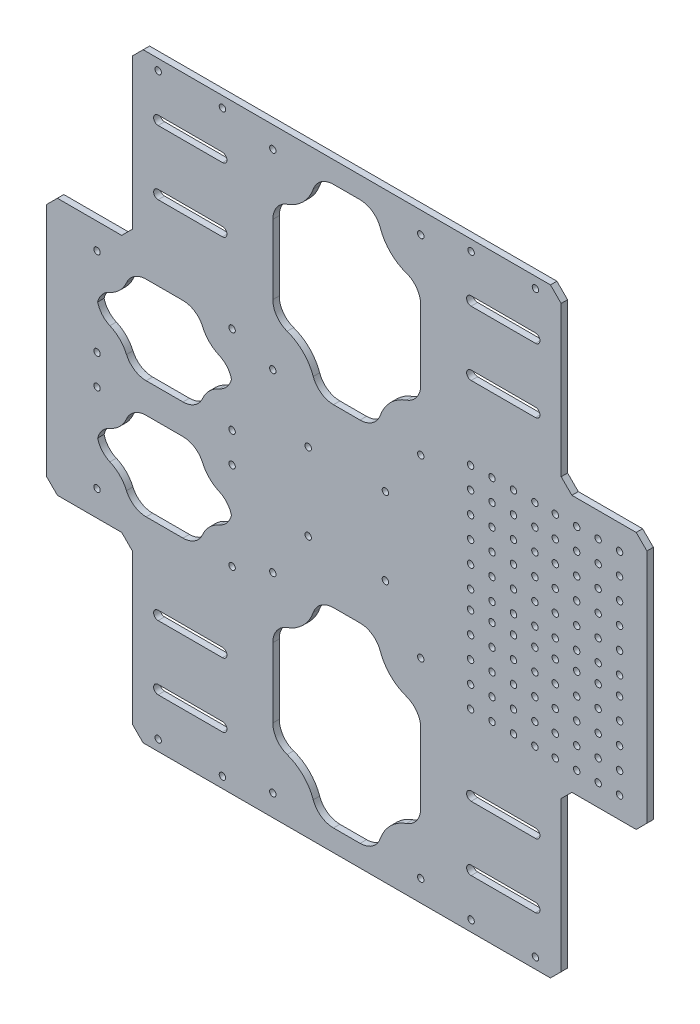
from build123d import *

# Parameters (mm, degrees)
SKETCH_1_R          = 1.5
EXTRUDE_1_DEPTH     = 3
CHAMFER_1_SIZE      = 5
SKETCH_3_R          = 1.5
CUT_EXTRUDE_2_DEPTH = 10
FILLET_1_R          = 10
SKETCH_4_R          = 1.5
CUT_EXTRUDE_3_DEPTH = 10


with BuildPart() as part:
    # 草图1 → 凸台-拉伸1 (new body)
    with BuildSketch(Plane.XY):
        Polygon((-100, -140), (-100, -60), (-140, -60), (-140, 60), (-100, 60), (-100, 140), (100, 140), (100, 60), (140, 60), (140, -60), (100, -60), (100, -140), align=None)
        with Locations((-34.5, -130)):
            Circle(SKETCH_1_R, mode=Mode.SUBTRACT)
        with Locations((-34.5, -41)):
            Circle(SKETCH_1_R, mode=Mode.SUBTRACT)
        with Locations(Location((34.5, -130, 0), (0, 0, 180))):
            Circle(SKETCH_1_R, mode=Mode.SUBTRACT)
        with Locations(Location((34.5, -41, 0), (0, 0, 180))):
            Circle(SKETCH_1_R, mode=Mode.SUBTRACT)
        with Locations(Location((-34.5, 130, 0), (0, 0, 180))):
            Circle(SKETCH_1_R, mode=Mode.SUBTRACT)
        with Locations((34.5, 130)):
            Circle(SKETCH_1_R, mode=Mode.SUBTRACT)
        with Locations((34.5, 41)):
            Circle(SKETCH_1_R, mode=Mode.SUBTRACT)
        with Locations(Location((-34.5, 41, 0), (0, 0, 180))):
            Circle(SKETCH_1_R, mode=Mode.SUBTRACT)
        with BuildLine():
            Line((-88, -82.9), (-58, -82.9))
            ThreePointArc((-58, -82.9), (-55.9, -85), (-58, -87.1))
            Line((-58, -87.1), (-88, -87.1))
            ThreePointArc((-88, -87.1), (-90.1, -85), (-88, -82.9))
        make_face(mode=Mode.SUBTRACT)
        with BuildLine():
            Line((-88, -112.9), (-58, -112.9))
            ThreePointArc((-58, -112.9), (-55.9, -115), (-58, -117.1))
            Line((-58, -117.1), (-88, -117.1))
            ThreePointArc((-88, -117.1), (-90.1, -115), (-88, -112.9))
        make_face(mode=Mode.SUBTRACT)
        with BuildLine():
            Line((88, -112.9), (58, -112.9))
            ThreePointArc((58, -112.9), (55.9, -115), (58, -117.1))
            Line((58, -117.1), (88, -117.1))
            ThreePointArc((88, -117.1), (90.1, -115), (88, -112.9))
        make_face(mode=Mode.SUBTRACT)
        with BuildLine():
            Line((88, -82.9), (58, -82.9))
            ThreePointArc((58, -82.9), (55.9, -85), (58, -87.1))
            Line((58, -87.1), (88, -87.1))
            ThreePointArc((88, -87.1), (90.1, -85), (88, -82.9))
        make_face(mode=Mode.SUBTRACT)
        with BuildLine():
            Line((88, 112.9), (58, 112.9))
            ThreePointArc((58, 112.9), (55.9, 115), (58, 117.1))
            Line((58, 117.1), (88, 117.1))
            ThreePointArc((88, 117.1), (90.1, 115), (88, 112.9))
        make_face(mode=Mode.SUBTRACT)
        with BuildLine():
            Line((88, 82.9), (58, 82.9))
            ThreePointArc((58, 82.9), (55.9, 85), (58, 87.1))
            Line((58, 87.1), (88, 87.1))
            ThreePointArc((88, 87.1), (90.1, 85), (88, 82.9))
        make_face(mode=Mode.SUBTRACT)
        with BuildLine():
            Line((-88, 112.9), (-58, 112.9))
            ThreePointArc((-58, 112.9), (-55.9, 115), (-58, 117.1))
            Line((-58, 117.1), (-88, 117.1))
            ThreePointArc((-88, 117.1), (-90.1, 115), (-88, 112.9))
        make_face(mode=Mode.SUBTRACT)
        with BuildLine():
            Line((-88, 82.9), (-58, 82.9))
            ThreePointArc((-58, 82.9), (-55.9, 85), (-58, 87.1))
            Line((-58, 87.1), (-88, 87.1))
            ThreePointArc((-88, 87.1), (-90.1, 85), (-88, 82.9))
        make_face(mode=Mode.SUBTRACT)
    extrude(amount=EXTRUDE_1_DEPTH)

    # 倒角1
    chamfer_1_edges = [part.edges().sort_by_distance(p)[0] for p in [
        (-100, -140, 1.5),
        (-100, -60, 1.5),
        (-140, -60, 1.5),
        (-140, 60, 1.5),
        (-100, 60, 1.5),
        (-100, 140, 1.5),
        (100, 140, 1.5),
        (100, 60, 1.5),
        (140, 60, 1.5),
        (140, -60, 1.5),
        (100, -60, 1.5),
        (100, -140, 1.5),
    ]]
    chamfer(chamfer_1_edges, length=CHAMFER_1_SIZE)

    # 草图3 → 切除-拉伸2 (cut)
    with BuildSketch(Plane.XY.offset(3)):
        with Locations((-88, 135)):
            Circle(SKETCH_3_R)
        with Locations((-58, 135)):
            Circle(SKETCH_3_R)
        with Locations((58, 135)):
            Circle(SKETCH_3_R)
        with Locations((88, 135)):
            Circle(SKETCH_3_R)
        with Locations((88, -135)):
            Circle(SKETCH_3_R)
        with Locations((58, -135)):
            Circle(SKETCH_3_R)
        with Locations((-58, -135)):
            Circle(SKETCH_3_R)
        with Locations((-88, -135)):
            Circle(SKETCH_3_R)
        with Locations((-18, 18)):
            Circle(SKETCH_3_R)
        with Locations((18, 18)):
            Circle(SKETCH_3_R)
        with Locations((18, -18)):
            Circle(SKETCH_3_R)
        with Locations((-18, -18)):
            Circle(SKETCH_3_R)
        with Locations((-116.5, 48)):
            Circle(SKETCH_3_R)
        with Locations((-53.5, 48)):
            Circle(SKETCH_3_R)
        with Locations((-53.5, 7)):
            Circle(SKETCH_3_R)
        with Locations((-116.5, 7)):
            Circle(SKETCH_3_R)
        with Locations((-53.5, -7)):
            Circle(SKETCH_3_R)
        with Locations((-53.5, -48)):
            Circle(SKETCH_3_R)
        with Locations((-116.5, -48)):
            Circle(SKETCH_3_R)
        with Locations((-116.5, -7)):
            Circle(SKETCH_3_R)
        with BuildLine():
            Line((-14.5, 130), (14.5, 130))
            ThreePointArc((14.5, 130), (20.357864376, 115.857864376), (34.5, 110))
            Line((34.5, 110), (34.5, 61))
            ThreePointArc((34.5, 61), (20.357864376, 55.142135624), (14.5, 41))
            Line((14.5, 41), (-14.5, 41))
            ThreePointArc((-14.5, 41), (-20.357864376, 55.142135624), (-34.5, 61))
            Line((-34.5, 61), (-34.5, 110))
            ThreePointArc((-34.5, 110), (-20.357864376, 115.857864376), (-14.5, 130))
        make_face()
        with BuildLine():
            Line((-14.5, -41), (14.5, -41))
            ThreePointArc((14.5, -41), (20.357864376, -55.142135624), (34.5, -61))
            Line((34.5, -61), (34.5, -110))
            ThreePointArc((34.5, -110), (20.357864376, -115.857864376), (14.5, -130))
            Line((14.5, -130), (-14.5, -130))
            ThreePointArc((-14.5, -130), (-20.357864376, -115.857864376), (-34.5, -110))
            Line((-34.5, -110), (-34.5, -61))
            ThreePointArc((-34.5, -61), (-20.357864376, -55.142135624), (-14.5, -41))
        make_face()
        with BuildLine():
            Line((-101.5, -48), (-68.5, -48))
            ThreePointArc((-68.5, -48), (-64.106601718, -37.393398282), (-53.5, -33))
            Line((-53.5, -33), (-53.5, -22))
            ThreePointArc((-53.5, -22), (-64.106601718, -17.606601718), (-68.5, -7))
            Line((-68.5, -7), (-101.5, -7))
            ThreePointArc((-101.5, -7), (-105.893398282, -17.606601718), (-116.5, -22))
            Line((-116.5, -22), (-116.5, -33))
            ThreePointArc((-116.5, -33), (-105.893398282, -37.393398282), (-101.5, -48))
        make_face()
        with BuildLine():
            Line((-101.5, 7), (-68.5, 7))
            ThreePointArc((-68.5, 7), (-64.106601718, 17.606601718), (-53.5, 22))
            Line((-53.5, 22), (-53.5, 33))
            ThreePointArc((-53.5, 33), (-64.106601718, 37.393398282), (-68.5, 48))
            Line((-68.5, 48), (-101.5, 48))
            ThreePointArc((-101.5, 48), (-105.893398282, 37.393398282), (-116.5, 33))
            Line((-116.5, 33), (-116.5, 22))
            ThreePointArc((-116.5, 22), (-105.893398282, 17.606601718), (-101.5, 7))
        make_face()
    extrude(amount=-CUT_EXTRUDE_2_DEPTH, mode=Mode.SUBTRACT)

    # 圆角1
    # the kernel refuses this fillet: 10 mm, written as the material it adds along each edge
    with BuildSketch(Plane(origin=(-34.5, -61, 3), x_dir=(0, -1, 0), z_dir=(0, 0, -1)), Plane(origin=(34.5, -110, 3), x_dir=(0, 1, 0), z_dir=(0, 0, -1)), Plane(origin=(-14.5, -130, 3), x_dir=(1, 0, 0), z_dir=(0, 0, -1)), Plane(origin=(-14.5, 41, 3), x_dir=(1, 0, 0), z_dir=(0, 0, -1)), Plane(origin=(34.5, 61, 3), x_dir=(0, 1, 0), z_dir=(0, 0, -1)), Plane(origin=(14.5, 130, 3), x_dir=(-1, 0, 0), z_dir=(0, 0, -1))) as fillet_1_piece_1:
        with BuildLine():
            CenterArc((8.284271247, -10), FILLET_1_R, 90, 70.528779366)
            ThreePointArc((-1.143819168, -6.666666667), (-0.288028807, -3.382039575), (0, 0))
            Line((0, 0), (8.284271247, 0))
        make_face()
    extrude(amount=3)
    with BuildSketch(Plane(origin=(-14.5, -41, 3), x_dir=(-0.16910197872576244, -0.9855985596534887, 0), z_dir=(0, 0, -1)), Plane(origin=(34.5, -61, 3), x_dir=(-0.9855985596534886, 0.1691019787257639, 0), z_dir=(0, 0, -1)), Plane(origin=(14.5, -130, 3), x_dir=(0.1691019787257637, 0.9855985596534885, 0), z_dir=(0, 0, -1)), Plane(origin=(-34.5, -110, 3), x_dir=(0.9855985596534889, -0.16910197872576282, 0), z_dir=(0, 0, -1)), Plane(origin=(-34.5, 61, 3), x_dir=(0.9855985596534889, -0.16910197872576255, 0), z_dir=(0, 0, -1)), Plane(origin=(14.5, 41, 3), x_dir=(0.16910197872576177, 0.9855985596534889, 0), z_dir=(0, 0, -1)), Plane(origin=(34.5, 110, 3), x_dir=(-0.9855985596534889, 0.16910197872576255, 0), z_dir=(0, 0, -1)), Plane(origin=(-14.5, 130, 3), x_dir=(-0.16910197872576238, -0.9855985596534889, 0), z_dir=(0, 0, -1))) as fillet_1_piece_2:
        with BuildLine():
            CenterArc((8.455098936, -9.855985597), FILLET_1_R, 99.735610317, 70.528779366)
            Line((-1.40088666, -8.164965809), (0, 0))
            ThreePointArc((0, 0), (3.382039575, -0.288028807), (6.764079149, 0))
        make_face()
    extrude(amount=3)
    with BuildSketch(Plane(origin=(14.5, -41, 3), x_dir=(0.16910197872576202, -0.9855985596534889, 0), z_dir=(0, 0, -1)), Plane(origin=(-34.5, 110, 3), x_dir=(0.9855985596534889, 0.16910197872576263, 0), z_dir=(0, 0, -1))) as fillet_1_piece_3:
        with BuildLine():
            CenterArc((8.455098936, 9.855985597), FILLET_1_R, 189.735610317, 70.528779366)
            Line((-1.40088666, 8.164965809), (0, 0))
            ThreePointArc((0, 0), (3.382039575, 0.288028807), (6.764079149, 0))
        make_face()
    extrude(amount=3)
    with BuildSketch(Plane(origin=(-68.5, -7, 3), x_dir=(-1, 0, 0), z_dir=(0, 0, -1)), Plane(origin=(-116.5, -22, 3), x_dir=(0, -1, 0), z_dir=(0, 0, -1)), Plane(origin=(-101.5, -48, 3), x_dir=(1, 0, 0), z_dir=(0, 0, -1)), Plane(origin=(-53.5, -33, 3), x_dir=(0, 1, 0), z_dir=(0, 0, -1)), Plane(origin=(-53.5, 22, 3), x_dir=(0, 1, 0), z_dir=(0, 0, -1)), Plane(origin=(-68.5, 48, 3), x_dir=(-1, 0, 0), z_dir=(0, 0, -1)), Plane(origin=(-101.5, 7, 3), x_dir=(1, 0, 0), z_dir=(0, 0, -1)), Plane(origin=(-116.5, 33, 3), x_dir=(0, -1, 0), z_dir=(0, 0, -1))) as fillet_1_piece_4:
        with BuildLine():
            CenterArc((7.912878475, -10), FILLET_1_R, 90, 66.421821522)
            ThreePointArc((-1.252272915, -6), (-0.316405306, -3.064644655), (0, 0))
            Line((0, 0), (7.912878475, 0))
        make_face()
    extrude(amount=3)
    with BuildSketch(Plane(origin=(-101.5, -7, 3), x_dir=(-0.20430964368921975, -0.9789063129307033, 0), z_dir=(0, 0, -1)), Plane(origin=(-68.5, -48, 3), x_dir=(0.2043096436892201, 0.9789063129307033, 0), z_dir=(0, 0, -1)), Plane(origin=(-53.5, -22, 3), x_dir=(-0.9789063129307031, 0.20430964368922072, 0), z_dir=(0, 0, -1)), Plane(origin=(-53.5, 33, 3), x_dir=(-0.9789063129307033, 0.2043096436892201, 0), z_dir=(0, 0, -1)), Plane(origin=(-68.5, 7, 3), x_dir=(0.20430964368921953, 0.9789063129307034, 0), z_dir=(0, 0, -1)), Plane(origin=(-101.5, 48, 3), x_dir=(-0.2043096436892172, -0.978906312930704, 0), z_dir=(0, 0, -1))) as fillet_1_piece_5:
        with BuildLine():
            CenterArc((8.172385748, -9.789063129), FILLET_1_R, 101.789089239, 66.421821522)
            Line((-1.616677382, -7.745966692), (0, 0))
            ThreePointArc((0, 0), (3.064644655, -0.316405306), (6.129289311, 0))
        make_face()
    extrude(amount=3)
    with BuildSketch(Plane(origin=(-116.5, -33, 3), x_dir=(0, 1, 0), z_dir=(0, 0, -1)), Plane(origin=(-116.5, 22, 3), x_dir=(0, 1, 0), z_dir=(0, 0, -1))) as fillet_1_piece_6:
        with BuildLine():
            CenterArc((7.912878475, 10), FILLET_1_R, 203.578178478, 66.421821522)
            ThreePointArc((-1.252272915, 6), (-0.316405306, 3.064644655), (0, 0))
            Line((0, 0), (7.912878475, 0))
        make_face()
    extrude(amount=3)

    # 草图4 → 切除-拉伸3 (cut)
    with BuildSketch(Plane.XY.offset(3)):
        with Locations((57.75, 48.5)):
            Circle(SKETCH_4_R)
        with Locations((57.75, -10)):
            Circle(SKETCH_4_R)
        with Locations((67.75, 48.5)):
            Circle(SKETCH_4_R)
        with Locations((67.75, -10)):
            Circle(SKETCH_4_R)
        with Locations((77.75, 48.5)):
            Circle(SKETCH_4_R)
        with Locations((77.75, -10)):
            Circle(SKETCH_4_R)
        with Locations((87.75, 48.5)):
            Circle(SKETCH_4_R)
        with Locations((87.75, -10)):
            Circle(SKETCH_4_R)
        with Locations((57.75, 38.5)):
            Circle(SKETCH_4_R)
        with Locations((67.75, 38.5)):
            Circle(SKETCH_4_R)
        with Locations((77.75, 38.5)):
            Circle(SKETCH_4_R)
        with Locations((87.75, 38.5)):
            Circle(SKETCH_4_R)
        with Locations((57.75, 28.5)):
            Circle(SKETCH_4_R)
        with Locations((67.75, 28.5)):
            Circle(SKETCH_4_R)
        with Locations((77.75, 28.5)):
            Circle(SKETCH_4_R)
        with Locations((87.75, 28.5)):
            Circle(SKETCH_4_R)
        with Locations((57.75, 18.5)):
            Circle(SKETCH_4_R)
        with Locations((67.75, 18.5)):
            Circle(SKETCH_4_R)
        with Locations((77.75, 18.5)):
            Circle(SKETCH_4_R)
        with Locations((87.75, 18.5)):
            Circle(SKETCH_4_R)
        with Locations((57.75, 8.5)):
            Circle(SKETCH_4_R)
        with Locations((67.75, 8.5)):
            Circle(SKETCH_4_R)
        with Locations((77.75, 8.5)):
            Circle(SKETCH_4_R)
        with Locations((87.75, 8.5)):
            Circle(SKETCH_4_R)
        with Locations((57.75, -1.5)):
            Circle(SKETCH_4_R)
        with Locations((67.75, -1.5)):
            Circle(SKETCH_4_R)
        with Locations((77.75, -1.5)):
            Circle(SKETCH_4_R)
        with Locations((87.75, -1.5)):
            Circle(SKETCH_4_R)
        with Locations((57.75, -20)):
            Circle(SKETCH_4_R)
        with Locations((67.75, -20)):
            Circle(SKETCH_4_R)
        with Locations((77.75, -20)):
            Circle(SKETCH_4_R)
        with Locations((87.75, -20)):
            Circle(SKETCH_4_R)
        with Locations((57.75, -30)):
            Circle(SKETCH_4_R)
        with Locations((67.75, -30)):
            Circle(SKETCH_4_R)
        with Locations((77.75, -30)):
            Circle(SKETCH_4_R)
        with Locations((87.75, -30)):
            Circle(SKETCH_4_R)
        with Locations((57.75, -40)):
            Circle(SKETCH_4_R)
        with Locations((67.75, -40)):
            Circle(SKETCH_4_R)
        with Locations((77.75, -40)):
            Circle(SKETCH_4_R)
        with Locations((87.75, -40)):
            Circle(SKETCH_4_R)
        with Locations((57.75, -50)):
            Circle(SKETCH_4_R)
        with Locations((67.75, -50)):
            Circle(SKETCH_4_R)
        with Locations((77.75, -50)):
            Circle(SKETCH_4_R)
        with Locations((87.75, -50)):
            Circle(SKETCH_4_R)
        with Locations((97.25, -50)):
            Circle(SKETCH_4_R)
        with Locations((107.25, -50)):
            Circle(SKETCH_4_R)
        with Locations((117.25, -50)):
            Circle(SKETCH_4_R)
        with Locations((127.25, -50)):
            Circle(SKETCH_4_R)
        with Locations((127.25, -40)):
            Circle(SKETCH_4_R)
        with Locations((117.25, -40)):
            Circle(SKETCH_4_R)
        with Locations((107.25, -40)):
            Circle(SKETCH_4_R)
        with Locations((97.25, -40)):
            Circle(SKETCH_4_R)
        with Locations((97.25, -30)):
            Circle(SKETCH_4_R)
        with Locations((107.25, -30)):
            Circle(SKETCH_4_R)
        with Locations((117.25, -30)):
            Circle(SKETCH_4_R)
        with Locations((127.25, -30)):
            Circle(SKETCH_4_R)
        with Locations((127.25, -20)):
            Circle(SKETCH_4_R)
        with Locations((117.25, -20)):
            Circle(SKETCH_4_R)
        with Locations((107.25, -20)):
            Circle(SKETCH_4_R)
        with Locations((97.25, -20)):
            Circle(SKETCH_4_R)
        with Locations((97.25, -10)):
            Circle(SKETCH_4_R)
        with Locations((107.25, -10)):
            Circle(SKETCH_4_R)
        with Locations((117.25, -10)):
            Circle(SKETCH_4_R)
        with Locations((127.25, -10)):
            Circle(SKETCH_4_R)
        with Locations((127.25, -1.5)):
            Circle(SKETCH_4_R)
        with Locations((117.25, -1.5)):
            Circle(SKETCH_4_R)
        with Locations((107.25, -1.5)):
            Circle(SKETCH_4_R)
        with Locations((97.25, -1.5)):
            Circle(SKETCH_4_R)
        with Locations((97.25, 8.5)):
            Circle(SKETCH_4_R)
        with Locations((107.25, 8.5)):
            Circle(SKETCH_4_R)
        with Locations((117.25, 8.5)):
            Circle(SKETCH_4_R)
        with Locations((127.25, 8.5)):
            Circle(SKETCH_4_R)
        with Locations((127.25, 18.5)):
            Circle(SKETCH_4_R)
        with Locations((117.25, 18.5)):
            Circle(SKETCH_4_R)
        with Locations((107.25, 18.5)):
            Circle(SKETCH_4_R)
        with Locations((97.25, 18.5)):
            Circle(SKETCH_4_R)
        with Locations((97.25, 28.5)):
            Circle(SKETCH_4_R)
        with Locations((107.25, 28.5)):
            Circle(SKETCH_4_R)
        with Locations((117.25, 28.5)):
            Circle(SKETCH_4_R)
        with Locations((127.25, 28.5)):
            Circle(SKETCH_4_R)
        with Locations((127.25, 38.5)):
            Circle(SKETCH_4_R)
        with Locations((117.25, 38.5)):
            Circle(SKETCH_4_R)
        with Locations((107.25, 38.5)):
            Circle(SKETCH_4_R)
        with Locations((97.25, 38.5)):
            Circle(SKETCH_4_R)
        with Locations((97.25, 48.5)):
            Circle(SKETCH_4_R)
        with Locations((107.25, 48.5)):
            Circle(SKETCH_4_R)
        with Locations((117.25, 48.5)):
            Circle(SKETCH_4_R)
        with Locations((127.25, 48.5)):
            Circle(SKETCH_4_R)
    extrude(amount=-CUT_EXTRUDE_3_DEPTH, mode=Mode.SUBTRACT)


solid = part.part
